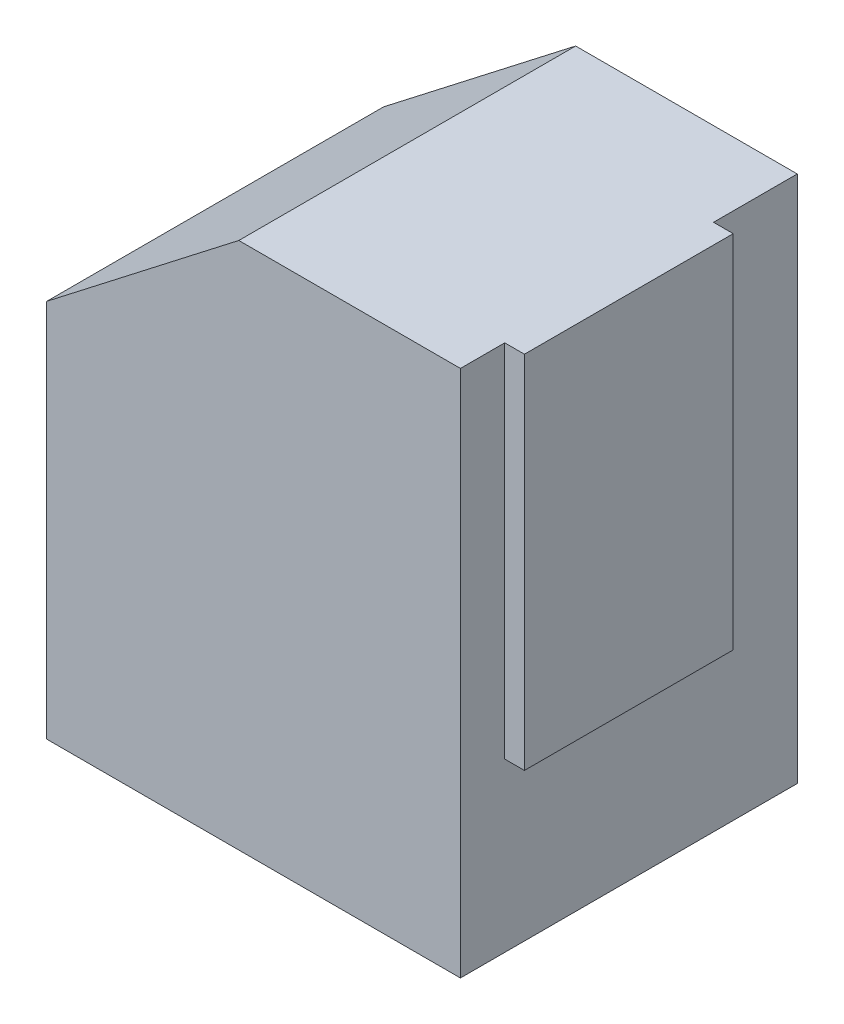
from build123d import *

# Parameters (mm, degrees)
BOSS_EXTRUDE1_DEPTH = 34.2
SKETCH2_R           = 8
CUT_EXTRUDE1_DEPTH  = 10
SKETCH3_W           = 21.2
SKETCH3_H           = 36.6
BOSS_EXTRUDE2_DEPTH = 2
SKETCH5_R           = 1.65
CUT_EXTRUDE4_DEPTH  = 10


with BuildPart() as part:
    # Sketch1 → Boss-Extrude1 (new body)
    with BuildSketch(Plane.XY):
        Polygon((0, 38.5), (19.5, 53.6), (42, 53.6), (42, 0), (0, 0), align=None)
    extrude(amount=BOSS_EXTRUDE1_DEPTH)

    # Sketch2 → Cut-Extrude1 (cut)
    with BuildSketch(Plane.XZ):
        with Locations((25, 23.2)):
            Circle(SKETCH2_R)
    extrude(amount=-CUT_EXTRUDE1_DEPTH, mode=Mode.SUBTRACT)

    # Sketch3 → Boss-Extrude2 (add)
    with BuildSketch(Plane(origin=(42, 0, 0), x_dir=(0, 0, -1), z_dir=(1, 0, 0))):
        with Locations((-19.1, 35.3)):
            Rectangle(SKETCH3_W, SKETCH3_H)
    extrude(amount=BOSS_EXTRUDE2_DEPTH)

    # Sketch5 → Cut-Extrude4 (cut)
    with BuildSketch(Plane(origin=(0, 0, 0), x_dir=(-1, 0, 0), z_dir=(0, 0, -1))):
        with Locations((-34.8, 3.8)):
            Circle(SKETCH5_R)
        with Locations((-3.8, 3.8)):
            Circle(SKETCH5_R)
        with Locations((-3.8, 34.8)):
            Circle(SKETCH5_R)
    extrude(amount=-CUT_EXTRUDE4_DEPTH, mode=Mode.SUBTRACT)


solid = part.part
